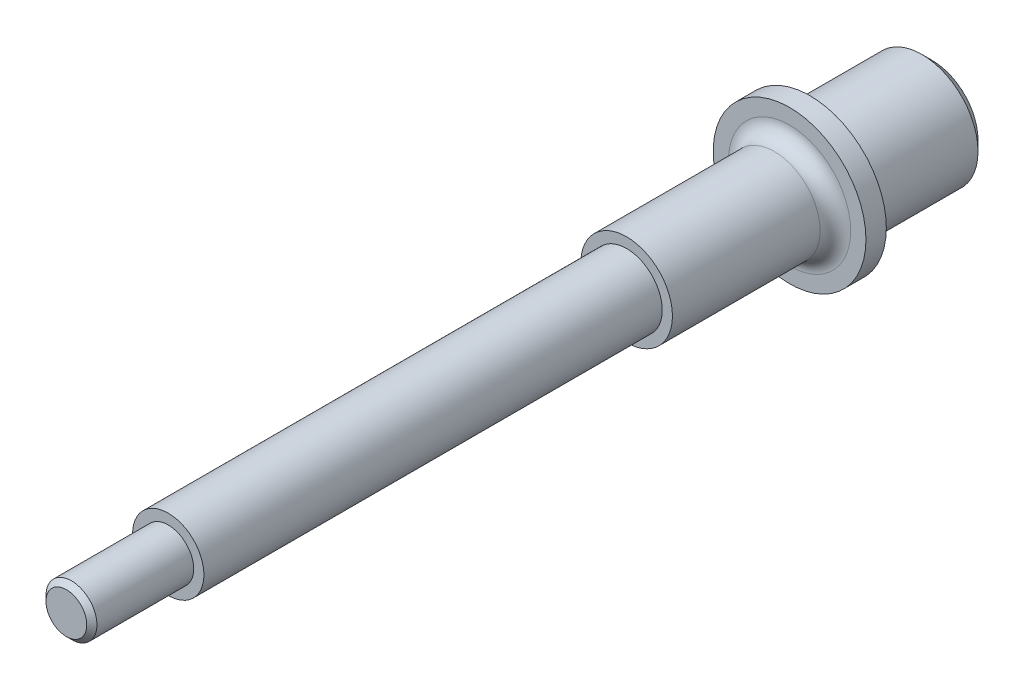
from build123d import *

# Parameters (mm, degrees)
ESBO_O1_R                = 11
RESSALTO_EXTRUS_O1_DEPTH = 24
ESBO_O2_R                = 15
RESSALTO_EXTRUS_O2_DEPTH = 4
ESBO_O3_R                = 9
RESSALTO_EXTRUS_O3_DEPTH = 32
ESBO_O4_R                = 7
RESSALTO_EXTRUS_O4_DEPTH = 90
ESBO_O5_R                = 5
RESSALTO_EXTRUS_O5_DEPTH = 20
CHANFRO1_SIZE            = 2
CHANFRO2_SIZE            = 1
FILETE2_R                = 3


with BuildPart() as part:
    # Esboço1 → Ressalto-extrusão1 (new body)
    with BuildSketch(Plane.XY):
        Circle(ESBO_O1_R)
    extrude(amount=RESSALTO_EXTRUS_O1_DEPTH)

    # Esboço2 → Ressalto-extrusão2 (add)
    with BuildSketch(Plane.XY.offset(24)):
        Circle(ESBO_O2_R)
    extrude(amount=RESSALTO_EXTRUS_O2_DEPTH)

    # Esboço3 → Ressalto-extrusão3 (add)
    with BuildSketch(Plane.XY.offset(28)):
        Circle(ESBO_O3_R)
    extrude(amount=RESSALTO_EXTRUS_O3_DEPTH)

    # Esboço4 → Ressalto-extrusão4 (add)
    with BuildSketch(Plane.XY.offset(60)):
        Circle(ESBO_O4_R)
    extrude(amount=RESSALTO_EXTRUS_O4_DEPTH)

    # Esboço5 → Ressalto-extrusão5 (add)
    with BuildSketch(Plane.XY.offset(150)):
        Circle(ESBO_O5_R)
    extrude(amount=RESSALTO_EXTRUS_O5_DEPTH)

    # Chanfro1
    chanfro1_edges = [part.edges().sort_by_distance(p)[0] for p in [
        (-11, 0, 0),
    ]]
    chamfer(chanfro1_edges, length=CHANFRO1_SIZE)

    # Chanfro2
    chanfro2_edges = [part.edges().sort_by_distance(p)[0] for p in [
        (-5, 0, 170),
    ]]
    chamfer(chanfro2_edges, length=CHANFRO2_SIZE)

    # Filete2
    filete2_edges = [part.edges().sort_by_distance(p)[0] for p in [
        (-9, 0, 28),
    ]]
    fillet(filete2_edges, radius=FILETE2_R)


solid = part.part
